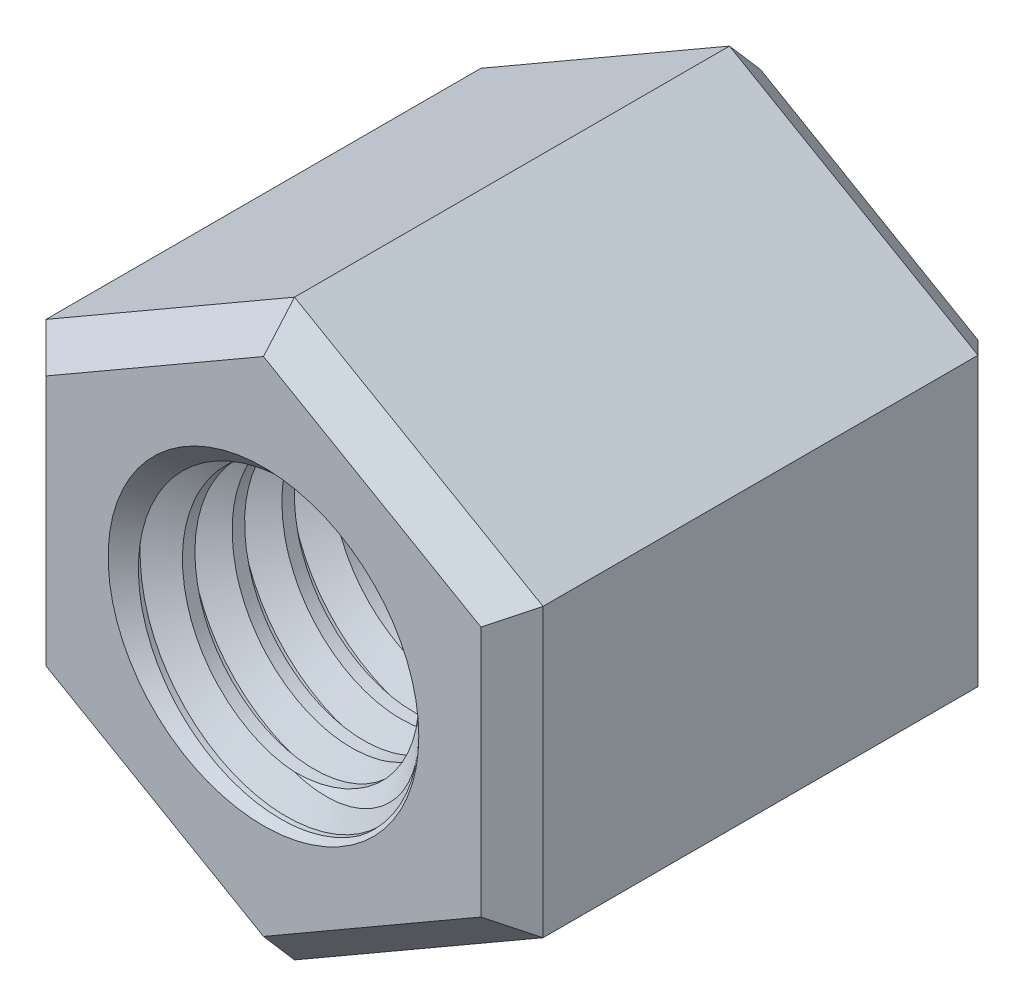
from build123d import *

# Parameters (mm, degrees)
BOSS_EXTRUDE1_DEPTH = 8
CHAMFER1_SIZE       = 0.5
SKETCH2_R           = 2
CUT_EXTRUDE1_DEPTH  = 8
CHAMFER2_SIZE       = 0.5
THREAD1_PITCH       = 0.8


with BuildPart() as part:
    # Sketch1 → Boss-Extrude1 (new body)
    with BuildSketch(Plane.XY):
        Polygon((0, -4.618802154), (4, -2.309401077), (4, 2.309401077), (0, 4.618802154), (-4, 2.309401077), (-4, -2.309401077), align=None)
    extrude(amount=BOSS_EXTRUDE1_DEPTH)

    # Chamfer1
    chamfer1_edges = [part.edges().sort_by_distance(p)[0] for p in [
        (4, 0, 8),
        (2, 3.464101615, 8),
        (-2, 3.464101615, 8),
        (-4, 0, 8),
        (-2, -3.464101615, 8),
        (-4, 0, 0),
        (-2, 3.464101615, 0),
        (2, 3.464101615, 0),
        (4, 0, 0),
        (2, -3.464101615, 0),
        (-2, -3.464101615, 0),
        (2, -3.464101615, 8),
    ]]
    chamfer(chamfer1_edges, length=CHAMFER1_SIZE)

    # Sketch2 → Cut-Extrude1 (cut)
    with BuildSketch(Plane.XY.offset(8)):
        Circle(SKETCH2_R)
    extrude(amount=-CUT_EXTRUDE1_DEPTH, mode=Mode.SUBTRACT)

    # Chamfer2
    chamfer2_edges = [part.edges().sort_by_distance(p)[0] for p in [
        (-2, 0, 0),
        (-2, 0, 8),
    ]]
    chamfer(chamfer2_edges, length=CHAMFER2_SIZE)

    # Thread1: the profile of Thread Profile1 profile screwed along a right-hand helix of 12.5 turns, 8 arcs to a turn; built about Z, then put on its axis
    thread1_z = Axis((0, 0, 0), (0, 0, 1))
    thread1_corners = [(1.9997, 0, -0.000173205), (2.4330127, 0, 0.249999999), (2.4330127, 0, 0.349999999), (1.9997, 0, 0.600173203)]
    with BuildLine(mode=Mode.PRIVATE) as thread1_profile:
        Line(thread1_corners[0], thread1_corners[1])
        Line(thread1_corners[1], thread1_corners[2])
        Line(thread1_corners[2], thread1_corners[3])
        Line(thread1_corners[3], thread1_corners[0])
    thread1_cap = Face(thread1_profile.wire())
    thread1_turn_angles = [0, 22.5, 45, 67.5, 90, 112.5, 135, 157.5, 180, 202.5, 225, 247.5, 270, 292.5, 315, 337.5, 360]
    thread1_turn_weights = [1, 0.9238795325112867, 1, 0.9238795325112867, 1, 0.9238795325112867, 1, 0.9238795325112867, 1, 0.9238795325112867, 1, 0.9238795325112867, 1, 0.9238795325112867, 1, 0.9238795325112867, 1]
    thread1_turn_rails = [Edge.make_bspline([Vector(p[0], p[1], 0).rotate(thread1_z, thread1_turn_angles[k]) / thread1_turn_weights[k] + Vector(0, 0, p[2] + THREAD1_PITCH * thread1_turn_angles[k] / 360) for k in range(17)], [0, 0, 0, 1, 1, 2, 2, 3, 3, 4, 4, 5, 5, 6, 6, 7, 7, 8, 8, 8], 2, thread1_turn_weights) for p in thread1_corners]
    thread1_turn_sides = [Face.make_surface_from_curves(thread1_turn_rails[p[0]], thread1_turn_rails[p[1]]) for p in [(0, 1), (1, 2), (2, 3), (3, 0)]]
    thread1_last_angles = [4320, 4342.5, 4365, 4387.5, 4410, 4432.5, 4455, 4477.5, 4500]
    thread1_last_weights = [1, 0.9238795325112867, 1, 0.9238795325112867, 1, 0.9238795325112867, 1, 0.9238795325112867, 1]
    thread1_last_rails = [Edge.make_bspline([Vector(p[0], p[1], 0).rotate(thread1_z, thread1_last_angles[k]) / thread1_last_weights[k] + Vector(0, 0, p[2] + THREAD1_PITCH * thread1_last_angles[k] / 360) for k in range(9)], [0, 0, 0, 1, 1, 2, 2, 3, 3, 4, 4, 4], 2, thread1_last_weights) for p in thread1_corners]
    thread1_last_sides = [Face.make_surface_from_curves(thread1_last_rails[p[0]], thread1_last_rails[p[1]]) for p in [(0, 1), (1, 2), (2, 3), (3, 0)]]
    thread1 = Plane(origin=(0, 0, 9.5), x_dir=(-1, 0, 0), z_dir=(0, 0, -1)) * Solid(Shell([*[p.moved(Location((0, 0, THREAD1_PITCH * i))) for i in range(12) for p in thread1_turn_sides], *thread1_last_sides, thread1_cap, thread1_cap.rotate(thread1_z, 4500).moved(Location((0, 0, THREAD1_PITCH * 4500 / 360)))]))
    add(thread1, mode=Mode.SUBTRACT)


solid = part.part
